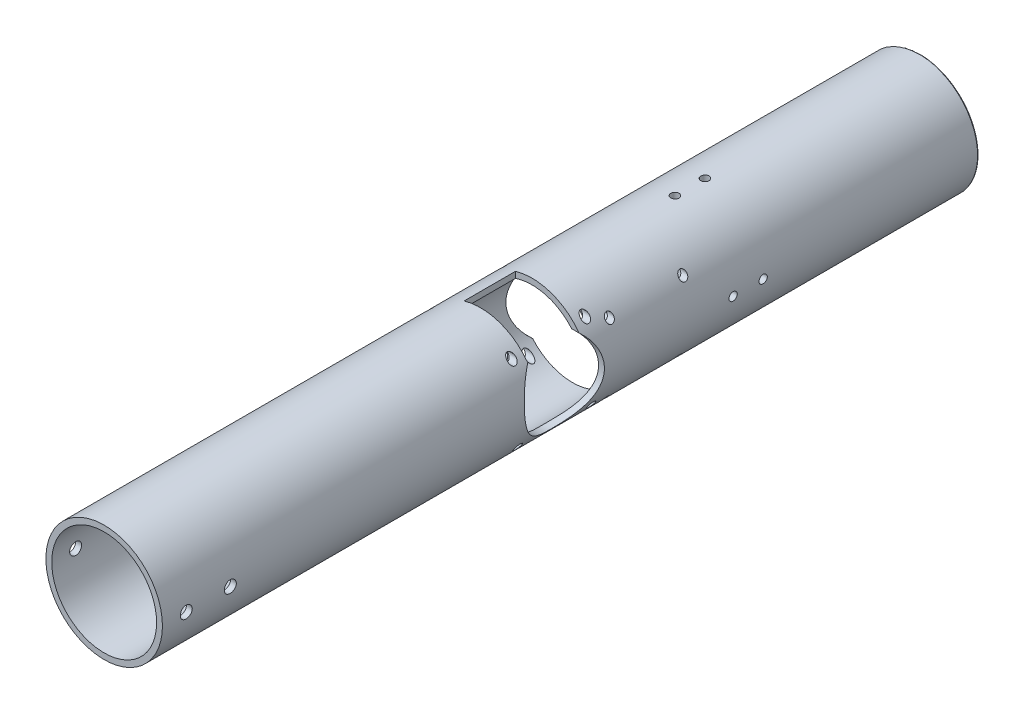
from build123d import *

# Parameters (mm, degrees)
BOSS_EXTRUDE1_DEPTH           = 125
BOSS_EXTRUDE1_DEPTH_BACK      = 250
SKETCH1_R                     = 31.75
SKETCH1_R_2                   = 28.575
SKETCH2_R                     = 21.75
CUT_EXTRUDE1_DEPTH            = 255.000246063
SKETCH3_R                     = 21.75
CUT_EXTRUDE2_DEPTH            = 255.000246187
CUT_EXTRUDE4_START            = 9
SKETCH5_W                     = 28
SKETCH5_H                     = 22
CUT_EXTRUDE4_DEPTH            = 264.000246187
CUT_EXTRUDE5_START            = -9
SKETCH6_W                     = 28
SKETCH6_H                     = 22
CUT_EXTRUDE5_DEPTH            = 264.000246187
CUT_EXTRUDE8_DEPTH            = 255.000246187
CUT_EXTRUDE8_DEPTH_BACK       = 255.000246187
SKETCH11_R                    = 2
CUT_EXTRUDE10_DEPTH           = 255.000246187
CUT_EXTRUDE10_DEPTH_BACK      = 255.000246187
SKETCH12_R                    = 3.25
CUT_EXTRUDE12_DEPTH           = 255.000246187
CUT_EXTRUDE12_DEPTH_BACK      = 255.000246187
SKETCH15_R                    = 2
SKETCH19_W                    = 2.25
SKETCH19_H                    = 31.75
M4_CLEARANCE_HOLE1_AT_2_COUNT = 2
M4_CLEARANCE_HOLE1_AT_2_PITCH = 40
M4_CLEARANCE_HOLE1_AT_3_COUNT = 2
M4_CLEARANCE_HOLE1_AT_3_PITCH = 40
M4_CLEARANCE_HOLE1_AT_4_COUNT = 2
M4_CLEARANCE_HOLE1_AT_4_PITCH = 56.568542495
M4_CLEARANCE_HOLE1_AT_5_COUNT = 2
M4_CLEARANCE_HOLE1_AT_5_PITCH = 90.126807577
M4_CLEARANCE_HOLE1_AT_6_COUNT = 2
M4_CLEARANCE_HOLE1_AT_6_PITCH = 50.197623888
M4_CLEARANCE_HOLE1_AT_7_COUNT = 2
M4_CLEARANCE_HOLE1_AT_7_PITCH = 100.213978286
M4_CLEARANCE_HOLE1_AT_8_COUNT = 2
M4_CLEARANCE_HOLE1_AT_8_PITCH = 66.631835064
MIRROR1_COPY_1_SKETCH_W       = 2.25
MIRROR1_COPY_1_SKETCH_H       = 31.75
MIRROR1_COPY_2_SKETCH_W       = 2.25
MIRROR1_COPY_2_SKETCH_H       = 31.75
MIRROR1_COPY_3_SKETCH_W       = 2.25
MIRROR1_COPY_3_SKETCH_H       = 31.75
MIRROR1_COPY_4_SKETCH_W       = 2.25
MIRROR1_COPY_4_SKETCH_H       = 31.75
MIRROR1_COPY_5_SKETCH_W       = 2.25
MIRROR1_COPY_5_SKETCH_H       = 31.75
MIRROR1_COPY_6_SKETCH_W       = 2.25
MIRROR1_COPY_6_SKETCH_H       = 31.75
MIRROR1_COPY_7_SKETCH_W       = 2.25
MIRROR1_COPY_7_SKETCH_H       = 31.75
SKETCH21_R                    = 30
CUT_EXTRUDE14_DEPTH           = 7
SKETCH22_R                    = 2.25
CUT_EXTRUDE15_DEPTH           = 255.000246187
CIRPATTERN2_COUNT             = 4
SKETCH23_R                    = 30
SKETCH23_R_2                  = 28.575
BOSS_EXTRUDE2_DEPTH           = 7
SKETCH24_R                    = 31.75
SKETCH24_R_2                  = 28.575
BOSS_EXTRUDE3_DEPTH           = 70.65
SKETCH25_R                    = 31.75
CUT_EXTRUDE16_DEPTH           = 1
FILLET1_R                     = 0.5


with BuildPart() as part:
    # Sketch1 → Boss-Extrude1 (new, two sides: drawn at the far end of the back side and taken through both)
    with BuildSketch(Plane.XY.offset(-BOSS_EXTRUDE1_DEPTH_BACK)):
        Circle(SKETCH1_R)
        Circle(SKETCH1_R_2, mode=Mode.SUBTRACT)
    extrude(amount=BOSS_EXTRUDE1_DEPTH + BOSS_EXTRUDE1_DEPTH_BACK)

    # Sketch2 → Cut-Extrude1 (cut, through all)
    with BuildSketch(Plane(origin=(0, 0, 0), x_dir=(0, 0, -1), z_dir=(1, 0, 0))):
        with Locations((73.488, -2)):
            Circle(SKETCH2_R)
    extrude(amount=-CUT_EXTRUDE1_DEPTH, mode=Mode.SUBTRACT)

    # Sketch3 → Cut-Extrude2 (cut, through all)
    with BuildSketch(Plane(origin=(0, 0, 0), x_dir=(0, 0, -1), z_dir=(1, 0, 0))):
        with Locations(Location((23.45, 2, 0), (0, 0, 354.723969399))):
            Circle(SKETCH3_R)
    extrude(amount=CUT_EXTRUDE2_DEPTH, mode=Mode.SUBTRACT)

    # Sketch5 → Cut-Extrude4 (cut, through all)
    with BuildSketch(Plane(origin=(0, 0, 0), x_dir=(0, 0, -1), z_dir=(1, 0, 0)).offset(CUT_EXTRUDE4_START)):
        with Locations((73.488, -23.75)):
            Rectangle(SKETCH5_W, SKETCH5_H)
    extrude(amount=-CUT_EXTRUDE4_DEPTH, mode=Mode.SUBTRACT)

    # Sketch6 → Cut-Extrude5 (cut, through all)
    with BuildSketch(Plane(origin=(0, 0, 0), x_dir=(0, 0, -1), z_dir=(1, 0, 0)).offset(CUT_EXTRUDE5_START)):
        with Locations((23.45, 23.75)):
            Rectangle(SKETCH6_W, SKETCH6_H)
    extrude(amount=CUT_EXTRUDE5_DEPTH, mode=Mode.SUBTRACT)

    # Sketch11 → Cut-Extrude8 (cut, two sides: drawn at the far end of the back side and taken through both)
    with BuildSketch(Plane(origin=(0, 0, 0), x_dir=(0, 0, -1), z_dir=(1, 0, 0)).offset(-CUT_EXTRUDE8_DEPTH_BACK)):
        with Locations((93.488, 18)):
            Circle(SKETCH11_R)
        with Locations((53.488, 18)):
            Circle(SKETCH11_R)
        with Locations((53.488, -22)):
            Circle(SKETCH11_R)
        with Locations((93.488, -22)):
            Circle(SKETCH11_R)
    extrude(amount=CUT_EXTRUDE8_DEPTH + CUT_EXTRUDE8_DEPTH_BACK, mode=Mode.SUBTRACT)

    # Sketch12 → Cut-Extrude10 (cut, two sides: drawn at the far end of the back side and taken through both)
    with BuildSketch(Plane(origin=(0, 0, 0), x_dir=(0, 0, -1), z_dir=(1, 0, 0)).offset(-CUT_EXTRUDE10_DEPTH_BACK)):
        with Locations((-112, 0)):
            Circle(SKETCH12_R)
        with Locations((-88, 0)):
            Circle(SKETCH12_R)
    extrude(amount=CUT_EXTRUDE10_DEPTH + CUT_EXTRUDE10_DEPTH_BACK, mode=Mode.SUBTRACT)

    # Sketch15 → Cut-Extrude12 (cut, two sides: drawn at the far end of the back side and taken through both)
    with BuildSketch(Plane(origin=(0, 0, 0), x_dir=(0, 0, -1), z_dir=(1, 0, 0)).offset(-CUT_EXTRUDE12_DEPTH_BACK)):
        with Locations((3.45, 22)):
            Circle(SKETCH15_R)
        with Locations((43.45, 22)):
            Circle(SKETCH15_R)
        with Locations((43.45, -18)):
            Circle(SKETCH15_R)
        with Locations((3.45, -18)):
            Circle(SKETCH15_R)
    extrude(amount=CUT_EXTRUDE12_DEPTH + CUT_EXTRUDE12_DEPTH_BACK, mode=Mode.SUBTRACT)

    # Sketch19 → M4 Clearance Hole1 (revolve, cut)
    with BuildSketch(Plane(origin=(0, 22, -3.45), x_dir=(0, 0, 1), z_dir=(0, 1, 0))):
        with Locations((1.125, 15.875)):
            Rectangle(SKETCH19_W, SKETCH19_H)
    m4_clearance_hole1 = revolve(axis=Axis((-6.35, 22, -3.45), (1, 0, 0)), mode=Mode.SUBTRACT)

    # M4 Clearance Hole1 at 2: M4 Clearance Hole1 ×2
    with Locations(*[(0, 0, -i * M4_CLEARANCE_HOLE1_AT_2_PITCH) for i in range(1, M4_CLEARANCE_HOLE1_AT_2_COUNT)]):
        add(m4_clearance_hole1, mode=Mode.SUBTRACT)

    # M4 Clearance Hole1 at 3: M4 Clearance Hole1 ×2
    with Locations(*[(0, -i * M4_CLEARANCE_HOLE1_AT_3_PITCH, 0) for i in range(1, M4_CLEARANCE_HOLE1_AT_3_COUNT)]):
        add(m4_clearance_hole1, mode=Mode.SUBTRACT)

    # M4 Clearance Hole1 at 4: M4 Clearance Hole1 ×2
    with Locations(*[Vector(0, -0.7071067811865478, -0.7071067811865472) * (i * M4_CLEARANCE_HOLE1_AT_4_PITCH) for i in range(1, M4_CLEARANCE_HOLE1_AT_4_COUNT)]):
        add(m4_clearance_hole1, mode=Mode.SUBTRACT)

    # M4 Clearance Hole1 at 5: M4 Clearance Hole1 ×2
    with Locations(*[Vector(0, -0.04438191152602306, -0.9990146374950151) * (i * M4_CLEARANCE_HOLE1_AT_5_PITCH) for i in range(1, M4_CLEARANCE_HOLE1_AT_5_COUNT)]):
        add(m4_clearance_hole1, mode=Mode.SUBTRACT)

    # M4 Clearance Hole1 at 6: M4 Clearance Hole1 ×2
    with Locations(*[Vector(0, -0.07968504662542611, -0.9968200907607669) * (i * M4_CLEARANCE_HOLE1_AT_6_PITCH) for i in range(1, M4_CLEARANCE_HOLE1_AT_6_COUNT)]):
        add(m4_clearance_hole1, mode=Mode.SUBTRACT)

    # M4 Clearance Hole1 at 7: M4 Clearance Hole1 ×2
    with Locations(*[Vector(0, -0.43906050585303297, -0.8984574960453493) * (i * M4_CLEARANCE_HOLE1_AT_7_PITCH) for i in range(1, M4_CLEARANCE_HOLE1_AT_7_COUNT)]):
        add(m4_clearance_hole1, mode=Mode.SUBTRACT)

    # M4 Clearance Hole1 at 8: M4 Clearance Hole1 ×2
    with Locations(*[Vector(0, -0.6603450131265124, -0.7509623583369185) * (i * M4_CLEARANCE_HOLE1_AT_8_PITCH) for i in range(1, M4_CLEARANCE_HOLE1_AT_8_COUNT)]):
        add(m4_clearance_hole1, mode=Mode.SUBTRACT)

    # Mirror1: M4 Clearance Hole1 across plane
    add(m4_clearance_hole1.mirror(Plane(origin=(0, 0, 0), x_dir=(0, 0, 1), z_dir=(1, 0, 0))), mode=Mode.SUBTRACT)

    # Mirror1 copy 1 sketch → Mirror1 copy 1 (revolve, cut)
    with BuildSketch(Plane(origin=(0, 22, -43.45), x_dir=(0, 0, 1), z_dir=(0, 1, 0))):
        with Locations((1.125, -15.875)):
            Rectangle(MIRROR1_COPY_1_SKETCH_W, MIRROR1_COPY_1_SKETCH_H)
    revolve(axis=Axis((6.35, 22, -43.45), (1, 0, 0)), mode=Mode.SUBTRACT)

    # Mirror1 copy 2 sketch → Mirror1 copy 2 (revolve, cut)
    with BuildSketch(Plane(origin=(0, -18, -3.45), x_dir=(0, 0, 1), z_dir=(0, 1, 0))):
        with Locations((1.125, -15.875)):
            Rectangle(MIRROR1_COPY_2_SKETCH_W, MIRROR1_COPY_2_SKETCH_H)
    revolve(axis=Axis((6.35, -18, -3.45), (1, 0, 0)), mode=Mode.SUBTRACT)

    # Mirror1 copy 3 sketch → Mirror1 copy 3 (revolve, cut)
    with BuildSketch(Plane(origin=(0, -18, -43.45), x_dir=(0, 0, 1), z_dir=(0, 1, 0))):
        with Locations((1.125, -15.875)):
            Rectangle(MIRROR1_COPY_3_SKETCH_W, MIRROR1_COPY_3_SKETCH_H)
    revolve(axis=Axis((6.35, -18, -43.45), (1, 0, 0)), mode=Mode.SUBTRACT)

    # Mirror1 copy 4 sketch → Mirror1 copy 4 (revolve, cut)
    with BuildSketch(Plane(origin=(0, 18, -93.488), x_dir=(0, 0, 1), z_dir=(0, 1, 0))):
        with Locations((1.125, -15.875)):
            Rectangle(MIRROR1_COPY_4_SKETCH_W, MIRROR1_COPY_4_SKETCH_H)
    revolve(axis=Axis((6.35, 18, -93.488), (1, 0, 0)), mode=Mode.SUBTRACT)

    # Mirror1 copy 5 sketch → Mirror1 copy 5 (revolve, cut)
    with BuildSketch(Plane(origin=(0, 18, -53.488), x_dir=(0, 0, 1), z_dir=(0, 1, 0))):
        with Locations((1.125, -15.875)):
            Rectangle(MIRROR1_COPY_5_SKETCH_W, MIRROR1_COPY_5_SKETCH_H)
    revolve(axis=Axis((6.35, 18, -53.488), (1, 0, 0)), mode=Mode.SUBTRACT)

    # Mirror1 copy 6 sketch → Mirror1 copy 6 (revolve, cut)
    with BuildSketch(Plane(origin=(0, -22, -93.488), x_dir=(0, 0, 1), z_dir=(0, 1, 0))):
        with Locations((1.125, -15.875)):
            Rectangle(MIRROR1_COPY_6_SKETCH_W, MIRROR1_COPY_6_SKETCH_H)
    revolve(axis=Axis((6.35, -22, -93.488), (1, 0, 0)), mode=Mode.SUBTRACT)

    # Mirror1 copy 7 sketch → Mirror1 copy 7 (revolve, cut)
    with BuildSketch(Plane(origin=(0, -22, -53.488), x_dir=(0, 0, 1), z_dir=(0, 1, 0))):
        with Locations((1.125, -15.875)):
            Rectangle(MIRROR1_COPY_7_SKETCH_W, MIRROR1_COPY_7_SKETCH_H)
    revolve(axis=Axis((6.35, -22, -53.488), (1, 0, 0)), mode=Mode.SUBTRACT)

    # Sketch21 → Cut-Extrude14 (cut)
    with BuildSketch(Plane(origin=(0, 0, -250), x_dir=(-1, 0, 0), z_dir=(0, 0, -1))):
        Circle(SKETCH21_R)
    extrude(amount=-CUT_EXTRUDE14_DEPTH, mode=Mode.SUBTRACT)

    # Sketch22 → Cut-Extrude15 (cut, through all)
    with BuildSketch(Plane(origin=(0, 0, 0), x_dir=(0, 0, -1), z_dir=(1, 0, 0))):
        with Locations(Location((131.65, 0, 0), (0, 0, 180))):
            Circle(SKETCH22_R)
        with Locations(Location((115.3, 0, 0), (0, 0, 180))):
            Circle(SKETCH22_R)
    cut_extrude15 = extrude(amount=CUT_EXTRUDE15_DEPTH, mode=Mode.SUBTRACT)

    # CirPattern2: Cut-Extrude15 ×4 about axis
    cirpattern2_axis = Axis((0, 0, -250), (0, 0, 1))
    for i in range(1, CIRPATTERN2_COUNT):
        add(cut_extrude15.rotate(cirpattern2_axis, i * 360 / CIRPATTERN2_COUNT), mode=Mode.SUBTRACT)

    # Sketch23 → Boss-Extrude2 (add)
    with BuildSketch(Plane(origin=(0, 0, -243), x_dir=(-1, 0, 0), z_dir=(0, 0, -1))):
        Circle(SKETCH23_R)
        with Locations(Location((0, 0, 0), (0, 0, 180))):
            Circle(SKETCH23_R_2, mode=Mode.SUBTRACT)
    extrude(amount=BOSS_EXTRUDE2_DEPTH)


with BuildPart() as body_2:
    # Split1: the piece on the far side of the plane
    add(part.part)
    split(bisect_by=Plane.XY.offset(75), keep=Keep.BOTTOM)


with BuildPart() as part_1:
    add(part.part)

    # Split1
    split(bisect_by=Plane.XY.offset(75), keep=Keep.TOP)


with BuildPart() as part_2:
    # Body-Move/Copy1: moved
    add(part_1.part.moved(Location((0, 0, 70.65))))


    add(body_2.part)  # Boss-Extrude3 merges body 2
    # Sketch24 → Boss-Extrude3 (add)
    with BuildSketch(Plane.XY.offset(75)):
        Circle(SKETCH24_R)
        Circle(SKETCH24_R_2, mode=Mode.SUBTRACT)
    extrude(amount=BOSS_EXTRUDE3_DEPTH)

    # Sketch25 → Cut-Extrude16 (cut)
    with BuildSketch(Plane(origin=(0, 0, -250), x_dir=(-1, 0, 0), z_dir=(0, 0, -1))):
        with Locations(Location((0, 0, 0), (0, 0, 180))):
            Circle(SKETCH25_R)
    extrude(amount=-CUT_EXTRUDE16_DEPTH, mode=Mode.SUBTRACT)

    # Fillet1
    fillet1_edges = [part_2.edges().sort_by_distance(p)[0] for p in [
        (-31.75, 0, -249),
        (-28.575, 0, -249),
    ]]
    fillet(fillet1_edges, radius=FILLET1_R)


solid = part_2.part
